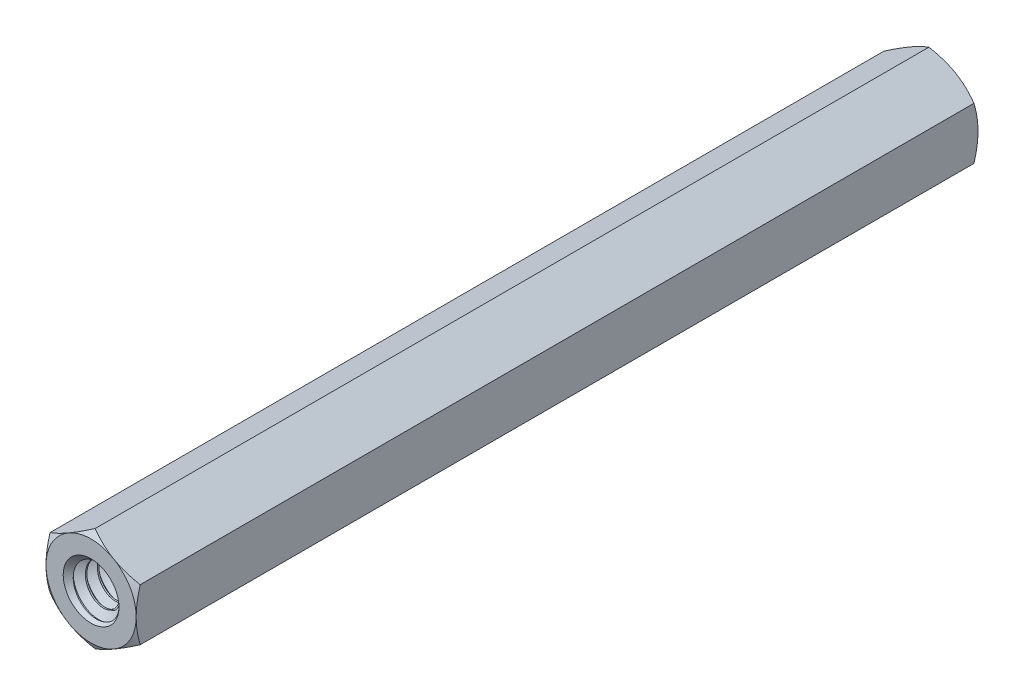
from build123d import *

# Parameters (mm, degrees)
EXTRUDE1_DEPTH          = 22.225
EXTRUDE1_DEPTH_BACK     = 22.225
SKETCH1_R               = 1.4224
SWEEP1_PITCH            = 0.635
EXTRUDE2_DEPTH          = 46.231666709
SKETCH8_OUTSIDE_W       = 176.046
SKETCH8_OUTSIDE_H       = 176.784
SKETCH8_OUTSIDE_R       = 2.38125
EXTRUDE4_DEPTH          = 46.231666709
EXTRUDE4_DRAFT          = -60
MIRROR1_COPY_1_SKETCH_W = 176.046
MIRROR1_COPY_1_SKETCH_H = 176.784
MIRROR1_COPY_1_SKETCH_R = 2.38125
MIRROR1_COPY_1_DEPTH    = 46.231666709
MIRROR1_COPY_1_DRAFT    = -60
SKETCH9_W               = 31.75
SKETCH9_H               = 1.4732


with BuildPart() as part:
    # Sketch1 → Extrude1 (new, two sides: drawn at the far end of the back side and taken through both)
    with BuildSketch(Plane.XY.offset(-EXTRUDE1_DEPTH_BACK)):
        Polygon((0, 2.749630657), (-2.38125, 1.374815329), (-2.38125, -1.374815329), (0, -2.749630657), (2.38125, -1.374815329), (2.38125, 1.374815329), align=None)
        Circle(SKETCH1_R, mode=Mode.SUBTRACT)
    extrude(amount=EXTRUDE1_DEPTH + EXTRUDE1_DEPTH_BACK)

    # Sweep1: arcs per turn and ends read off the stored shape
    # Sweep1: the profile of Sketch12 profile screwed along a right-hand helix through 71 turns, 6 arcs to a turn; built about Z, then put on its axis
    sweep1_z = Axis((0, 0, 0), (0, 0, 1))
    sweep1_corners = [(1.4227, 0, -0.555798205), (1.4227, 0, 0.000173205), (1.009955401, 0, -0.238125), (1.009955401, 0, -0.3175)]
    with BuildLine(mode=Mode.PRIVATE) as sweep1_profile:
        Line(sweep1_corners[0], sweep1_corners[1])
        Line(sweep1_corners[1], sweep1_corners[2])
        Line(sweep1_corners[2], sweep1_corners[3])
        Line(sweep1_corners[3], sweep1_corners[0])
    sweep1_cap = Face(sweep1_profile.wire())
    sweep1_turn_angles = [0, 30, 60, 90, 120, 150, 180, 210, 240, 270, 300, 330, 360]
    sweep1_turn_weights = [1, 0.8660254037844387, 1, 0.8660254037844387, 1, 0.8660254037844387, 1, 0.8660254037844387, 1, 0.8660254037844387, 1, 0.8660254037844387, 1]
    sweep1_turn_rails = [Edge.make_bspline([Vector(p[0], p[1], 0).rotate(sweep1_z, sweep1_turn_angles[k]) / sweep1_turn_weights[k] + Vector(0, 0, p[2] + SWEEP1_PITCH * sweep1_turn_angles[k] / 360) for k in range(13)], [0, 0, 0, 1, 1, 2, 2, 3, 3, 4, 4, 5, 5, 6, 6, 6], 2, sweep1_turn_weights) for p in sweep1_corners]
    sweep1_turn_sides = [Face.make_surface_from_curves(sweep1_turn_rails[p[0]], sweep1_turn_rails[p[1]]) for p in [(0, 1), (1, 2), (2, 3), (3, 0)]]
    sweep1 = Plane(origin=(0, 0, -22.225), x_dir=(0, 1, 0), z_dir=(0, 0, 1)) * Solid(Shell([*[p.moved(Location((0, 0, SWEEP1_PITCH * i))) for i in range(71) for p in sweep1_turn_sides], sweep1_cap, sweep1_cap.rotate(sweep1_z, 25560).moved(Location((0, 0, SWEEP1_PITCH * 25560 / 360)))]))
    add(sweep1)

    # Sketch6 → Extrude2 (cut, through all)
    with BuildSketch(Plane(origin=(0, 0, -22.225), x_dir=(-1, 0, 0), z_dir=(0, 0, -1))):
        Polygon((0, 2.749630657), (-2.38125, 1.374815329), (-2.38125, -1.374815329), (0, -2.749630657), (2.38125, -1.374815329), (2.38125, 1.374815329), align=None)
    extrude2 = extrude(amount=EXTRUDE2_DEPTH, mode=Mode.SUBTRACT)

    # Extrude3 cone 1 section (through the dimple's axis) → Extrude3 (revolve, cut)
    with BuildSketch(Plane(origin=(0, 0, -22.225), x_dir=(0, 1, 0), z_dir=(1, 0, 0))):
        Polygon((0, 0), (1.4732, 0), (0, 1.579813584), align=None)
    extrude3 = revolve(axis=Axis((0, 0, -22.225), (0, 0, 1)), mode=Mode.SUBTRACT)


with BuildPart() as extrude4_tool:
    # Sketch8 outside → Extrude4 (with draft: the straight prism first)
    with BuildSketch(Plane(origin=(0, 0, -22.225), x_dir=(-1, 0, 0), z_dir=(0, 0, -1))):
        Rectangle(SKETCH8_OUTSIDE_W, SKETCH8_OUTSIDE_H)
        Circle(SKETCH8_OUTSIDE_R, mode=Mode.SUBTRACT)
    extrude(amount=-EXTRUDE4_DEPTH)
    # Extrude4: the draft: its side faces are tilted about the plane it starts from
    extrude4_sides = [extrude4_tool.faces().sort_by_distance(p)[0] for p in [
        (0, -88.392, 0.890833355),
        (-88.023, 0, 0.890833355),
        (0, 88.392, 0.890833355),
        (88.023, 0, 0.890833355),
        (2.38125, 0, 0.890833355),
    ]]
    draft(extrude4_sides, Plane(origin=(0, 0, -22.225), x_dir=(-1, 0, 0), z_dir=(0, 0, -1)), EXTRUDE4_DRAFT)


with BuildPart() as part_1:
    add(part.part)

    # Extrude4: cut by extrude4_tool
    add(extrude4_tool.part, mode=Mode.SUBTRACT)

    # Mirror1: Extrude2, Extrude3 across plane
    add(extrude2.mirror(Plane.XY), mode=Mode.SUBTRACT)
    add(extrude3.mirror(Plane.XY), mode=Mode.SUBTRACT)


with BuildPart() as mirror1_copy_1_tool:
    # Mirror1 copy 1 sketch → Mirror1 copy 1 (with draft: the straight prism first)
    with BuildSketch(Plane(origin=(0, 0, 22.225), x_dir=(-1, 0, 0), z_dir=(0, 0, 1))):
        Rectangle(MIRROR1_COPY_1_SKETCH_W, MIRROR1_COPY_1_SKETCH_H)
        Circle(MIRROR1_COPY_1_SKETCH_R, mode=Mode.SUBTRACT)
    extrude(amount=-MIRROR1_COPY_1_DEPTH)
    # Mirror1 copy 1: the draft: its side faces are tilted about the plane it starts from
    mirror1_copy_1_sides = [mirror1_copy_1_tool.faces().sort_by_distance(p)[0] for p in [
        (0, -88.392, -0.890833355),
        (-88.023, 0, -0.890833355),
        (0, 88.392, -0.890833355),
        (88.023, 0, -0.890833355),
        (2.38125, 0, -0.890833355),
    ]]
    draft(mirror1_copy_1_sides, Plane(origin=(0, 0, 22.225), x_dir=(-1, 0, 0), z_dir=(0, 0, 1)), MIRROR1_COPY_1_DRAFT)


with BuildPart() as part_2:
    add(part_1.part)

    # Mirror1 copy 1: cut by mirror1_copy_1_tool
    add(mirror1_copy_1_tool.part, mode=Mode.SUBTRACT)

    # Sketch9 → Revolve 2 (revolve)
    with BuildSketch(Plane(origin=(0, 0, 0), x_dir=(0, 0, -1), z_dir=(1, 0, 0)), mode=Mode.PRIVATE) as revolve_2_sk:
        with Locations((0, 0.7366)):
            Rectangle(SKETCH9_W, SKETCH9_H)
    revolve(revolve_2_sk.sketch.rotate(Axis((0, 0, 22.225), (0, 0, -1)), 270), axis=Axis((0, 0, 22.225), (0, 0, -1)))


solid = part_2.part
